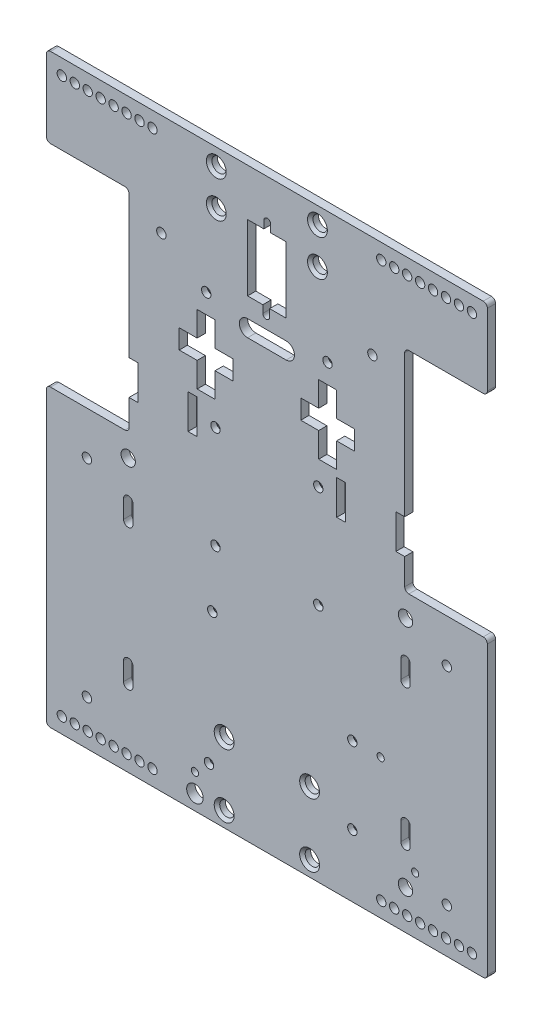
from build123d import *

# Parameters (mm, degrees)
BOSS_EXTRUDE1_DEPTH = 3
SKETCH2_R           = 1.7
CUT_EXTRUDE1_DEPTH  = 3
SKETCH3_R           = 1.7
CUT_EXTRUDE2_DEPTH  = 3
SKETCH4_R           = 1.7
CUT_EXTRUDE3_DEPTH  = 3
CUT_EXTRUDE6_DEPTH  = 3
FILLET1_R           = 1.5
FILLET2_R           = 1.5
SKETCH7_R           = 2.6
CUT_EXTRUDE7_DEPTH  = 3
SKETCH8_W           = 3.2
SKETCH8_H           = 12.5
CUT_EXTRUDE9_DEPTH  = 3
SKETCH9_W           = 3.25
SKETCH9_H           = 12.5
CUT_EXTRUDE10_DEPTH = 3
CUT_EXTRUDE12_DEPTH = 3
SKETCH11_R          = 1.7
CUT_EXTRUDE14_DEPTH = 3
SKETCH12_R          = 1.7
CUT_EXTRUDE16_DEPTH = 3
SKETCH13_R          = 1.7
CUT_EXTRUDE18_DEPTH = 3
SKETCH14_R          = 1.3
CUT_EXTRUDE20_DEPTH = 3
SKETCH15_R          = 2.6
CUT_EXTRUDE21_DEPTH = 10
SKETCH16_R          = 3
SKETCH16_R_2        = 1.3
CUT_EXTRUDE24_DEPTH = 10
CHAMFER1_SIZE       = 1
CHAMFER2_SIZE       = 1
CHAMFER3_SIZE       = 1
CHAMFER4_SIZE       = 1
CHAMFER5_SIZE       = 1
CHAMFER6_SIZE       = 1
CHAMFER7_SIZE       = 1
CHAMFER8_SIZE       = 1
CHAMFER9_SIZE       = 1
CHAMFER10_SIZE      = 1
CHAMFER11_SIZE      = 1
CHAMFER12_SIZE      = 1
SKETCH17_R          = 2.6
CUT_EXTRUDE27_DEPTH = 10
FILLET3_R           = 1.5
FILLET4_R           = 1.5
CHAMFER13_SIZE      = 1
CHAMFER14_SIZE      = 1
CHAMFER15_SIZE      = 1
CHAMFER16_SIZE      = 1
CHAMFER17_SIZE      = 1
CHAMFER18_SIZE      = 1
FILLET5_R           = 1.5
FILLET6_R           = 1.5
FILLET7_R           = 1.5
FILLET8_R           = 1.5


with BuildPart() as part:
    # Sketch1 → Boss-Extrude1 (new body)
    with BuildSketch(Plane.XY):
        Polygon((-80, -100.362745098), (80, -100.362745098), (80, 6.637254902), (50, 6.637254902), (50, 83.137254902), (80, 83.137254902), (80, 112.137254902), (-80, 112.137254902), (-80, 83.137254902), (-50, 83.137254902), (-50, 6.637254902), (-80, 6.637254902), align=None)
    extrude(amount=BOSS_EXTRUDE1_DEPTH)

    # Sketch2 → Cut-Extrude1 (cut)
    with BuildSketch(Plane(origin=(0, 0, 0), x_dir=(-1, 0, 0), z_dir=(0, 0, -1))):
        with Locations((38.27958447, 75.137254902)):
            Circle(SKETCH2_R)
        with Locations((-38.27958447, 75.137254902)):
            Circle(SKETCH2_R)
        with BuildLine():
            Line((-7, 95.04531444), (-1.373901732, 95.04531444))
            Line((-1.373901732, 95.04531444), (-1.373901732, 97.778273136))
            ThreePointArc((-1.373901732, 97.778273136), (-0.139792235, 99.012382633), (1.094317261, 97.778273136))
            Line((1.094317261, 97.778273136), (1.094317261, 95.04531444))
            Line((1.094317261, 95.04531444), (7, 95.04531444))
            Line((7, 95.04531444), (7, 71.04531444))
            Line((7, 71.04531444), (1.469744896, 71.04531444))
            Line((1.469744896, 71.04531444), (1.469744896, 68.312355743))
            ThreePointArc((1.469744896, 68.312355743), (0.235635399, 67.078246247), (-0.998474097, 68.312355743))
            Line((-0.998474097, 68.312355743), (-0.998474097, 71.04531444))
            Line((-0.998474097, 71.04531444), (-7, 71.04531444))
            Line((-7, 71.04531444), (-7, 95.04531444))
        make_face()
    extrude(amount=-CUT_EXTRUDE1_DEPTH, mode=Mode.SUBTRACT)

    # Sketch3 → Cut-Extrude2 (cut)
    with BuildSketch(Plane.XY.offset(3)):
        with Locations((-22, 64.68040086)):
            Circle(SKETCH3_R)
        with Locations((22, 64.68040086)):
            Circle(SKETCH3_R)
        with BuildLine():
            Line((-7, 63.896376565), (7, 63.896376565))
            ThreePointArc((7, 63.896376565), (10, 60.896376565), (7, 57.896376565))
            Line((7, 57.896376565), (-7, 57.896376565))
            ThreePointArc((-7, 57.896376565), (-10, 60.896376565), (-7, 63.896376565))
        make_face()
    extrude(amount=-CUT_EXTRUDE2_DEPTH, mode=Mode.SUBTRACT)

    # Sketch4 → Cut-Extrude3 (cut)
    with BuildSketch(Plane.XY.offset(3)):
        with Locations((74.4, 106.537254902)):
            Circle(SKETCH4_R)
        with Locations((69.7, 106.537254902)):
            Circle(SKETCH4_R)
        with Locations((65, 106.537254902)):
            Circle(SKETCH4_R)
        with Locations((60.3, 106.537254902)):
            Circle(SKETCH4_R)
        with Locations((55.6, 106.537254902)):
            Circle(SKETCH4_R)
        with Locations((50.9, 106.537254902)):
            Circle(SKETCH4_R)
        with Locations((46.2, 106.537254902)):
            Circle(SKETCH4_R)
        with Locations((41.5, 106.537254902)):
            Circle(SKETCH4_R)
        with Locations((-74.4, 106.537254902)):
            Circle(SKETCH4_R)
        with Locations((-69.7, 106.537254902)):
            Circle(SKETCH4_R)
        with Locations((-65, 106.537254902)):
            Circle(SKETCH4_R)
        with Locations((-60.3, 106.537254902)):
            Circle(SKETCH4_R)
        with Locations((-55.6, 106.537254902)):
            Circle(SKETCH4_R)
        with Locations((-50.9, 106.537254902)):
            Circle(SKETCH4_R)
        with Locations((-46.2, 106.537254902)):
            Circle(SKETCH4_R)
        with Locations((-41.5, 106.537254902)):
            Circle(SKETCH4_R)
        with Locations((-74.4, -94.762745098)):
            Circle(SKETCH4_R)
        with Locations((-69.7, -94.762745098)):
            Circle(SKETCH4_R)
        with Locations((-65, -94.762745098)):
            Circle(SKETCH4_R)
        with Locations((-60.3, -94.762745098)):
            Circle(SKETCH4_R)
        with Locations((-55.6, -94.762745098)):
            Circle(SKETCH4_R)
        with Locations((-50.9, -94.762745098)):
            Circle(SKETCH4_R)
        with Locations((-46.2, -94.762745098)):
            Circle(SKETCH4_R)
        with Locations((-41.5, -94.762745098)):
            Circle(SKETCH4_R)
        with Locations((41.5, -94.762745098)):
            Circle(SKETCH4_R)
        with Locations((46.2, -94.762745098)):
            Circle(SKETCH4_R)
        with Locations((50.9, -94.762745098)):
            Circle(SKETCH4_R)
        with Locations((55.6, -94.762745098)):
            Circle(SKETCH4_R)
        with Locations((60.3, -94.762745098)):
            Circle(SKETCH4_R)
        with Locations((65, -94.762745098)):
            Circle(SKETCH4_R)
        with Locations((69.7, -94.762745098)):
            Circle(SKETCH4_R)
        with Locations((74.4, -94.762745098)):
            Circle(SKETCH4_R)
    extrude(amount=-CUT_EXTRUDE3_DEPTH, mode=Mode.SUBTRACT)

    # Sketch6 → Cut-Extrude6 (cut)
    with BuildSketch(Plane.XY):
        Polygon((25.3, 57.637254902), (18.8, 57.637254902), (18.8, 48.637254902), (12.3, 48.637254902), (12.3, 41.637254902), (18.8, 41.637254902), (18.8, 32.637254902), (25.3, 32.637254902), (25.3, 41.637254902), (31.8, 41.637254902), (31.8, 48.637254902), (25.3, 48.637254902), align=None)
        Polygon((-31.8, 48.637254902), (-25.3, 48.637254902), (-25.3, 57.637254902), (-18.8, 57.637254902), (-18.8, 48.637254902), (-12.3, 48.637254902), (-12.3, 41.637254902), (-18.8, 41.637254902), (-18.8, 32.637254902), (-25.3, 32.637254902), (-25.3, 41.637254902), (-31.8, 41.637254902), align=None)
    extrude(amount=CUT_EXTRUDE6_DEPTH, mode=Mode.SUBTRACT)

    # Fillet1
    fillet1_edges = [part.edges().sort_by_distance(p)[0] for p in [
        (80, 83.137254902, 1.5),
        (80, 112.137254902, 1.5),
        (-80, 112.137254902, 1.5),
        (-80, 83.137254902, 1.5),
    ]]
    fillet(fillet1_edges, radius=FILLET1_R)

    # Fillet2
    fillet2_edges = [part.edges().sort_by_distance(p)[0] for p in [
        (80, -100.362745098, 1.5),
        (-80, -100.362745098, 1.5),
    ]]
    fillet(fillet2_edges, radius=FILLET2_R)

    # Sketch7 → Cut-Extrude7 (cut)
    with BuildSketch(Plane.XY.offset(3)):
        with Locations((-15.5, -94.862745098)):
            Circle(SKETCH7_R)
        with Locations((-15.5, -71.862745098)):
            Circle(SKETCH7_R)
        with Locations((15.5, -94.862745098)):
            Circle(SKETCH7_R)
        with Locations((15.5, -71.862745098)):
            Circle(SKETCH7_R)
    extrude(amount=-CUT_EXTRUDE7_DEPTH, mode=Mode.SUBTRACT)

    # Sketch8 → Cut-Extrude9 (cut)
    with BuildSketch(Plane.XY):
        with Locations((-48.4, 23.887254902)):
            Rectangle(SKETCH8_W, SKETCH8_H)
        with Locations((48.4, 23.887254902)):
            Rectangle(SKETCH8_W, SKETCH8_H)
    extrude(amount=CUT_EXTRUDE9_DEPTH, mode=Mode.SUBTRACT)

    # Sketch9 → Cut-Extrude10 (cut)
    with BuildSketch(Plane.XY.offset(3)):
        with Locations((-26.975, 23.887254902)):
            Rectangle(SKETCH9_W, SKETCH9_H)
        with Locations((26.975, 23.887254902)):
            Rectangle(SKETCH9_W, SKETCH9_H)
    extrude(amount=-CUT_EXTRUDE10_DEPTH, mode=Mode.SUBTRACT)

    # Sketch10 → Cut-Extrude12 (cut)
    with BuildSketch(Plane.XY):
        with BuildLine():
            Line((-48.6, -15.062745098), (-48.6, -21.662745098))
            ThreePointArc((-48.6, -21.662745098), (-50.3, -23.362745098), (-52, -21.662745098))
            Line((-52, -21.662745098), (-52, -15.062745098))
            ThreePointArc((-52, -15.062745098), (-50.3, -13.362745098), (-48.6, -15.062745098))
        make_face()
        with BuildLine():
            Line((-52, -66.062745098), (-52, -72.662745098))
            ThreePointArc((-52, -72.662745098), (-50.3, -74.362745098), (-48.6, -72.662745098))
            Line((-48.6, -72.662745098), (-48.6, -66.062745098))
            ThreePointArc((-48.6, -66.062745098), (-50.3, -64.362745098), (-52, -66.062745098))
        make_face()
        with BuildLine():
            Line((48.6, -66.062745098), (48.6, -72.662745098))
            ThreePointArc((48.6, -72.662745098), (50.3, -74.362745098), (52, -72.662745098))
            Line((52, -72.662745098), (52, -66.062745098))
            ThreePointArc((52, -66.062745098), (50.3, -64.362745098), (48.6, -66.062745098))
        make_face()
        with BuildLine():
            Line((48.6, -15.062745098), (48.6, -21.662745098))
            ThreePointArc((48.6, -21.662745098), (50.3, -23.362745098), (52, -21.662745098))
            Line((52, -21.662745098), (52, -15.062745098))
            ThreePointArc((52, -15.062745098), (50.3, -13.362745098), (48.6, -15.062745098))
        make_face()
    extrude(amount=CUT_EXTRUDE12_DEPTH, mode=Mode.SUBTRACT)

    # Sketch11 → Cut-Extrude14 (cut)
    with BuildSketch(Plane.XY):
        with Locations((-18.65, 23.887254902)):
            Circle(SKETCH11_R)
        with Locations((-18.65, -13.312745098)):
            Circle(SKETCH11_R)
        with Locations((18.65, -13.312745098)):
            Circle(SKETCH11_R)
        with Locations((18.65, 23.887254902)):
            Circle(SKETCH11_R)
    extrude(amount=CUT_EXTRUDE14_DEPTH, mode=Mode.SUBTRACT)

    # Sketch12 → Cut-Extrude16 (cut)
    with BuildSketch(Plane.XY):
        with Locations((65.3, -9.062745098)):
            Circle(SKETCH12_R)
        with Locations((-65.3, -9.062745098)):
            Circle(SKETCH12_R)
        with Locations((65.3, -84.162745098)):
            Circle(SKETCH12_R)
        with Locations((-65.3, -84.162745098)):
            Circle(SKETCH12_R)
    extrude(amount=CUT_EXTRUDE16_DEPTH, mode=Mode.SUBTRACT)

    # Sketch13 → Cut-Extrude18 (cut)
    with BuildSketch(Plane.XY):
        with Locations((-21, -82.862745098)):
            Circle(SKETCH13_R)
        with Locations((31, -77.662745098)):
            Circle(SKETCH13_R)
        with Locations((31, -49.762745098)):
            Circle(SKETCH13_R)
        with Locations((-19.8, -34.562745098)):
            Circle(SKETCH13_R)
    extrude(amount=CUT_EXTRUDE18_DEPTH, mode=Mode.SUBTRACT)

    # Sketch14 → Cut-Extrude20 (cut)
    with BuildSketch(Plane.XY):
        with Locations((53.8, -79.762745098)):
            Circle(SKETCH14_R)
        with Locations((41.3, -49.762745098)):
            Circle(SKETCH14_R)
    extrude(amount=CUT_EXTRUDE20_DEPTH, mode=Mode.SUBTRACT)

    # Sketch15 → Cut-Extrude21 (cut)
    with BuildSketch(Plane.XY):
        with Locations((50.3, -1.562745098)):
            Circle(SKETCH15_R)
        with Locations((-50.3, -1.562745098)):
            Circle(SKETCH15_R)
        with Locations((50.3, -86.162745098)):
            Circle(SKETCH15_R)
    extrude(amount=CUT_EXTRUDE21_DEPTH, mode=Mode.SUBTRACT)

    # Sketch16 → Cut-Extrude24 (cut)
    with BuildSketch(Plane.XY.offset(3)):
        with Locations((-26.1, -94.862745098)):
            Circle(SKETCH16_R)
        with Locations((-26.1, -88.062745098)):
            Circle(SKETCH16_R_2)
    extrude(amount=-CUT_EXTRUDE24_DEPTH, mode=Mode.SUBTRACT)

    # Chamfer1
    chamfer1_edges = [part.edges().sort_by_distance(p)[0] for p in [
        (-18.1, -71.862745098, 3),
    ]]
    chamfer(chamfer1_edges, length=CHAMFER1_SIZE)

    # Chamfer2
    chamfer2_edges = [part.edges().sort_by_distance(p)[0] for p in [
        (12.9, -71.862745098, 3),
    ]]
    chamfer(chamfer2_edges, length=CHAMFER2_SIZE)

    # Chamfer3
    chamfer3_edges = [part.edges().sort_by_distance(p)[0] for p in [
        (-18.1, -94.862745098, 3),
    ]]
    chamfer(chamfer3_edges, length=CHAMFER3_SIZE)

    # Chamfer4
    chamfer4_edges = [part.edges().sort_by_distance(p)[0] for p in [
        (12.9, -94.862745098, 3),
    ]]
    chamfer(chamfer4_edges, length=CHAMFER4_SIZE)

    # Chamfer5
    chamfer5_edges = [part.edges().sort_by_distance(p)[0] for p in [
        (16.95, 23.887254902, 0),
    ]]
    chamfer(chamfer5_edges, length=CHAMFER5_SIZE)

    # Chamfer6
    chamfer6_edges = [part.edges().sort_by_distance(p)[0] for p in [
        (-20.35, 23.887254902, 0),
    ]]
    chamfer(chamfer6_edges, length=CHAMFER6_SIZE)

    # Chamfer7
    chamfer7_edges = [part.edges().sort_by_distance(p)[0] for p in [
        (16.95, -13.312745098, 0),
    ]]
    chamfer(chamfer7_edges, length=CHAMFER7_SIZE)

    # Chamfer8
    chamfer8_edges = [part.edges().sort_by_distance(p)[0] for p in [
        (-20.35, -13.312745098, 0),
    ]]
    chamfer(chamfer8_edges, length=CHAMFER8_SIZE)

    # Chamfer9
    chamfer9_edges = [part.edges().sort_by_distance(p)[0] for p in [
        (-21.5, -34.562745098, 0),
    ]]
    chamfer(chamfer9_edges, length=CHAMFER9_SIZE)

    # Chamfer10
    chamfer10_edges = [part.edges().sort_by_distance(p)[0] for p in [
        (29.3, -49.762745098, 0),
    ]]
    chamfer(chamfer10_edges, length=CHAMFER10_SIZE)

    # Chamfer11
    chamfer11_edges = [part.edges().sort_by_distance(p)[0] for p in [
        (29.3, -77.662745098, 0),
    ]]
    chamfer(chamfer11_edges, length=CHAMFER11_SIZE)

    # Chamfer12
    chamfer12_edges = [part.edges().sort_by_distance(p)[0] for p in [
        (-22.7, -82.862745098, 0),
    ]]
    chamfer(chamfer12_edges, length=CHAMFER12_SIZE)

    # Sketch17 → Cut-Extrude27 (cut)
    with BuildSketch(Plane.XY):
        with Locations((-18.35, 106.037254902)):
            Circle(SKETCH17_R)
        with Locations((-18.35, 92.837254902)):
            Circle(SKETCH17_R)
        with Locations((18.35, 92.837254902)):
            Circle(SKETCH17_R)
        with Locations((18.35, 106.037254902)):
            Circle(SKETCH17_R)
    extrude(amount=CUT_EXTRUDE27_DEPTH, mode=Mode.SUBTRACT)

    # Fillet3
    fillet3_edges = [part.edges().sort_by_distance(p)[0] for p in [
        (80, 6.637254902, 1.5),
    ]]
    fillet(fillet3_edges, radius=FILLET3_R)

    # Fillet4
    fillet4_edges = [part.edges().sort_by_distance(p)[0] for p in [
        (-80, 6.637254902, 1.5),
    ]]
    fillet(fillet4_edges, radius=FILLET4_R)

    # Chamfer13
    chamfer13_edges = [part.edges().sort_by_distance(p)[0] for p in [
        (-20.95, 106.037254902, 3),
    ]]
    chamfer(chamfer13_edges, length=CHAMFER13_SIZE)

    # Chamfer14
    chamfer14_edges = [part.edges().sort_by_distance(p)[0] for p in [
        (15.75, 106.037254902, 3),
    ]]
    chamfer(chamfer14_edges, length=CHAMFER14_SIZE)

    # Chamfer15
    chamfer15_edges = [part.edges().sort_by_distance(p)[0] for p in [
        (-20.95, 92.837254902, 3),
    ]]
    chamfer(chamfer15_edges, length=CHAMFER15_SIZE)

    # Chamfer16
    chamfer16_edges = [part.edges().sort_by_distance(p)[0] for p in [
        (15.75, 92.837254902, 3),
    ]]
    chamfer(chamfer16_edges, length=CHAMFER16_SIZE)

    # Chamfer17
    chamfer17_edges = [part.edges().sort_by_distance(p)[0] for p in [
        (-23.7, 64.68040086, 0),
    ]]
    chamfer(chamfer17_edges, length=CHAMFER17_SIZE)

    # Chamfer18
    chamfer18_edges = [part.edges().sort_by_distance(p)[0] for p in [
        (20.3, 64.68040086, 0),
    ]]
    chamfer(chamfer18_edges, length=CHAMFER18_SIZE)

    # Fillet5
    fillet5_edges = [part.edges().sort_by_distance(p)[0] for p in [
        (50, 6.637254902, 1.5),
    ]]
    fillet(fillet5_edges, radius=FILLET5_R)

    # Fillet6
    fillet6_edges = [part.edges().sort_by_distance(p)[0] for p in [
        (50, 83.137254902, 1.5),
    ]]
    fillet(fillet6_edges, radius=FILLET6_R)

    # Fillet7
    fillet7_edges = [part.edges().sort_by_distance(p)[0] for p in [
        (-50, 83.137254902, 1.5),
    ]]
    fillet(fillet7_edges, radius=FILLET7_R)

    # Fillet8
    fillet8_edges = [part.edges().sort_by_distance(p)[0] for p in [
        (-50, 6.637254902, 1.5),
    ]]
    fillet(fillet8_edges, radius=FILLET8_R)


solid = part.part
